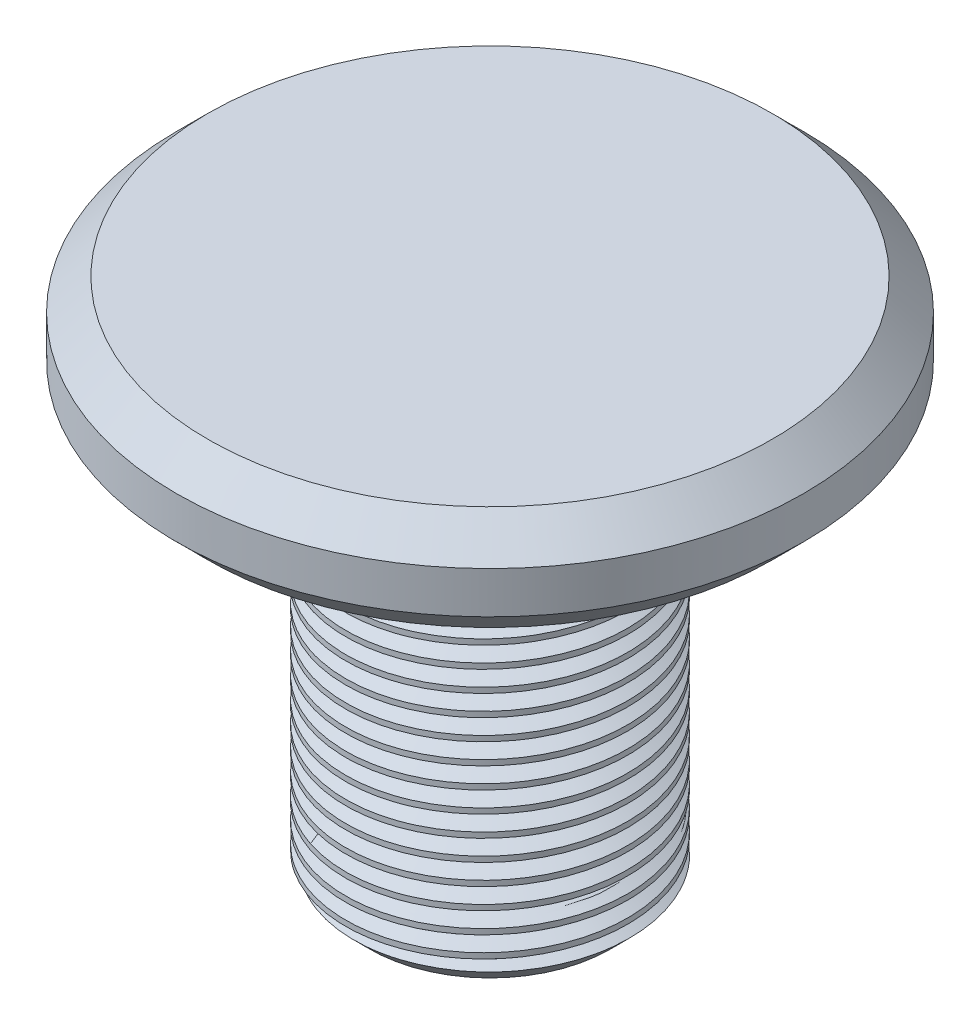
from build123d import *

# Parameters (mm, degrees)
CHAMFER_1_SIZE = 3
CHAMFER_2_SIZE = 2
SWEEP_1_PITCH  = 2


with BuildPart() as part:
    # 草圖1 → 旋轉1 (revolve)
    with BuildSketch(Plane.XY):
        Polygon((0, 0), (30, 0), (30, -10), (13.5, -10), (13.5, -50), (0, -50), align=None)
    revolve(axis=Axis((0, -1000, 0), (0, 1, 0)))

    # 導角1
    chamfer_1_edges = [part.edges().sort_by_distance(p)[0] for p in [
        (-30, -10, 0),
        (-30, 0, 0),
    ]]
    chamfer(chamfer_1_edges, length=CHAMFER_1_SIZE)

    # 導角2
    chamfer_2_edges = [part.edges().sort_by_distance(p)[0] for p in [
        (-13.5, -50, 0),
    ]]
    chamfer(chamfer_2_edges, length=CHAMFER_2_SIZE)

    # 除料-掃出1: arcs per turn and ends read off the stored shape
    # 除料-掃出1: the profile of 草圖3 screwed along a right-hand helix through 20.6 turns, 10 arcs to a turn; built about Z, then put on its axis
    sweep_1_z = Axis((0, 0, 0), (0, 0, 1))
    sweep_1_corners = [(13.52, 0, 0.749978), (12.221, 0, 0), (13.52, 0, -0.749978)]
    with BuildLine(mode=Mode.PRIVATE) as sweep_1_profile:
        Line(sweep_1_corners[0], sweep_1_corners[1])
        Line(sweep_1_corners[1], sweep_1_corners[2])
        Line(sweep_1_corners[2], sweep_1_corners[0])
    sweep_1_cap = Face(sweep_1_profile.wire())
    sweep_1_turn_angles = [0, 18, 36, 54, 72, 90, 108, 126, 144, 162, 180, 198, 216, 234, 252, 270, 288, 306, 324, 342, 360]
    sweep_1_turn_weights = [1, 0.9510565162951535, 1, 0.9510565162951535, 1, 0.9510565162951535, 1, 0.9510565162951535, 1, 0.9510565162951535, 1, 0.9510565162951535, 1, 0.9510565162951535, 1, 0.9510565162951535, 1, 0.9510565162951535, 1, 0.9510565162951535, 1]
    sweep_1_turn_rails = [Edge.make_bspline([Vector(p[0], p[1], 0).rotate(sweep_1_z, sweep_1_turn_angles[k]) / sweep_1_turn_weights[k] + Vector(0, 0, p[2] + SWEEP_1_PITCH * sweep_1_turn_angles[k] / 360) for k in range(21)], [0, 0, 0, 1, 1, 2, 2, 3, 3, 4, 4, 5, 5, 6, 6, 7, 7, 8, 8, 9, 9, 10, 10, 10], 2, sweep_1_turn_weights) for p in sweep_1_corners]
    sweep_1_turn_sides = [Face.make_surface_from_curves(sweep_1_turn_rails[p[0]], sweep_1_turn_rails[p[1]]) for p in [(0, 1), (1, 2), (2, 0)]]
    sweep_1_last_angles = [7200, 7218, 7236, 7254, 7272, 7290, 7308, 7326, 7344, 7362, 7380, 7398, 7416]
    sweep_1_last_weights = [1, 0.9510565162951535, 1, 0.9510565162951535, 1, 0.9510565162951535, 1, 0.9510565162951535, 1, 0.9510565162951535, 1, 0.9510565162951535, 1]
    sweep_1_last_rails = [Edge.make_bspline([Vector(p[0], p[1], 0).rotate(sweep_1_z, sweep_1_last_angles[k]) / sweep_1_last_weights[k] + Vector(0, 0, p[2] + SWEEP_1_PITCH * sweep_1_last_angles[k] / 360) for k in range(13)], [0, 0, 0, 1, 1, 2, 2, 3, 3, 4, 4, 5, 5, 6, 6, 6], 2, sweep_1_last_weights) for p in sweep_1_corners]
    sweep_1_last_sides = [Face.make_surface_from_curves(sweep_1_last_rails[p[0]], sweep_1_last_rails[p[1]]) for p in [(0, 1), (1, 2), (2, 0)]]
    sweep_1 = Plane(origin=(0, -50, 0), x_dir=(0, 0, 1), z_dir=(0, 1, 0)) * Solid(Shell([*[p.moved(Location((0, 0, SWEEP_1_PITCH * i))) for i in range(20) for p in sweep_1_turn_sides], *sweep_1_last_sides, sweep_1_cap, sweep_1_cap.rotate(sweep_1_z, 7416).moved(Location((0, 0, SWEEP_1_PITCH * 7416 / 360)))]))
    add(sweep_1, mode=Mode.SUBTRACT)


solid = part.part
